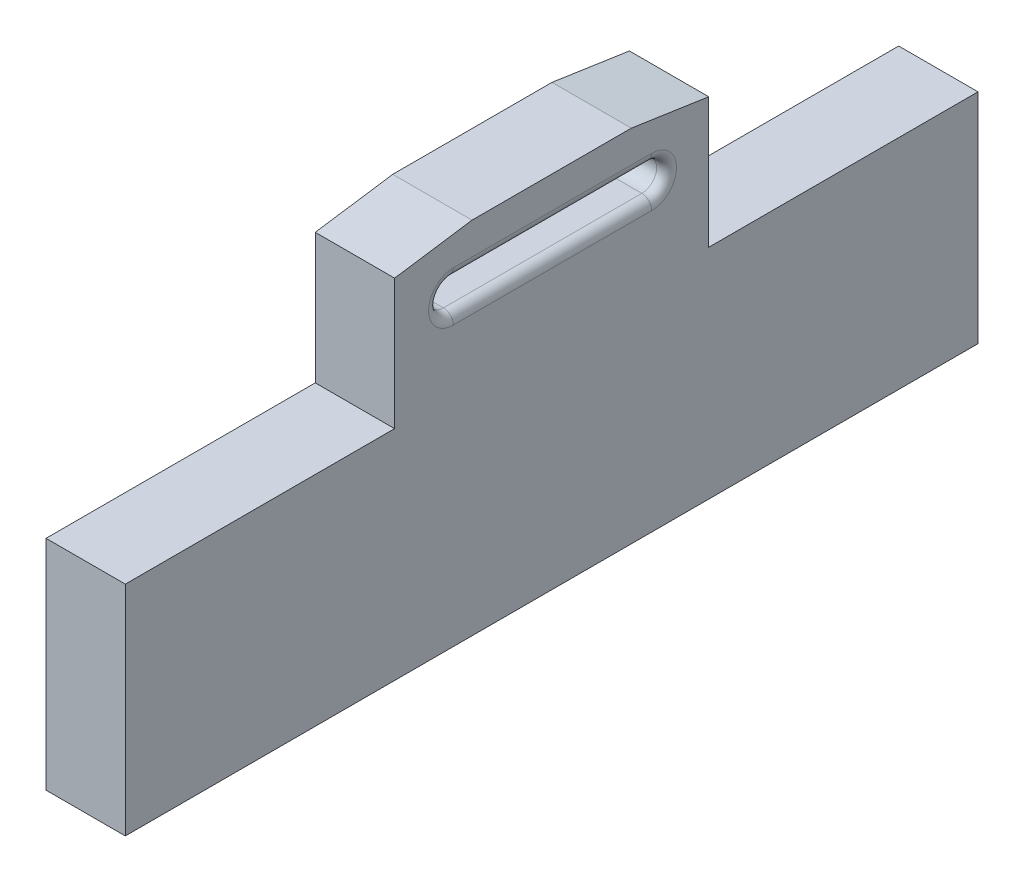
from build123d import *
from OCP.BRepAlgoAPI import BRepAlgoAPI_Cut
from OCP.TopTools import TopTools_ListOfShape

# Parameters (mm, degrees)
SKETCH_1_W          = 86
SKETCH_1_H          = 44.920858062
EXTRUDE_1_DEPTH     = 8
CUT_EXTRUDE_2_DEPTH = 92.635829898
CUT_EXTRUDE_3_DEPTH = 90.129115951
FILLET_1_R          = 1


with BuildPart() as part:
    # Эскиз1 → Вытянуть1 (new body)
    with BuildSketch(Plane(origin=(0, 0, 0), x_dir=(0, 0, -1), z_dir=(1, 0, 0))):
        with Locations((43, -8.152073661)):
            Rectangle(SKETCH_1_W, SKETCH_1_H)
    extrude(amount=EXTRUDE_1_DEPTH)


with BuildPart() as cut_extrude_2_tool:
    # Эскиз3 → Вырез-Вытянуть2 (new, through all)
    with BuildSketch(Plane.ZY):
        Polygon((0, -30.612502692), (-2.2e-07, -21.999984323), (-86, -21.999984323), (-86, -30.612502692), align=None)
        Polygon((0, 14.387497308), (-3.68e-07, 0), (-27.157261974, 0), (-27.157261974, 13.148042163), (-35.5, 14.387497308), align=None)
        Polygon((-58.842738026, 0), (-58.842738026, 13.148042163), (-50.5, 14.387497308), (-86, 14.387497308), (-85.999999632, 0), align=None)
    extrude(amount=-CUT_EXTRUDE_2_DEPTH)


with BuildPart() as part_1:
    add(part.part)

    # Вырез-Вытянуть2: cut by cut_extrude_2_tool, with a tolerance
    cut_extrude_2_stock = TopTools_ListOfShape()
    cut_extrude_2_stock.Append(part_1.part.wrapped)
    cut_extrude_2_tools = TopTools_ListOfShape()
    cut_extrude_2_tools.Append(cut_extrude_2_tool.part.wrapped)
    cut_extrude_2_cut = BRepAlgoAPI_Cut()
    cut_extrude_2_cut.SetArguments(cut_extrude_2_stock)
    cut_extrude_2_cut.SetTools(cut_extrude_2_tools)
    cut_extrude_2_cut.SetFuzzyValue(0.00001)
    cut_extrude_2_cut.Build()
    add(Compound.cast(cut_extrude_2_cut.Shape()).solids(), mode=Mode.REPLACE)

    # Эскиз4 → Вырез-Вытянуть3 (cut, through all)
    with BuildSketch(Plane.ZY):
        with BuildLine():
            Line((-53.089945506, 10.085003592), (-33.089945506, 10.085003592))
            ThreePointArc((-33.089945506, 10.085003592), (-31.589945506, 8.585003592), (-33.089945506, 7.085003592))
            Line((-33.089945506, 7.085003592), (-53.089945506, 7.085003592))
            ThreePointArc((-53.089945506, 7.085003592), (-54.589945506, 8.585003592), (-53.089945506, 10.085003592))
        make_face()
    extrude(amount=-CUT_EXTRUDE_3_DEPTH, mode=Mode.SUBTRACT)

    # Скругление1
    fillet_1_edges = [part_1.edges().sort_by_distance(p)[0] for p in [
        (8, 8.585003592, -31.589945506),
        (8, 7.085003592, -43.089945506),
        (8, 8.585003592, -54.589945506),
        (0, 8.585003592, -31.589945506),
        (0, 7.085003592, -43.089945506),
        (0, 8.585003592, -54.589945506),
        (8, 10.085003592, -43.089945506),
        (0, 10.085003592, -43.089945506),
    ]]
    fillet(fillet_1_edges, radius=FILLET_1_R)


solid = part_1.part
